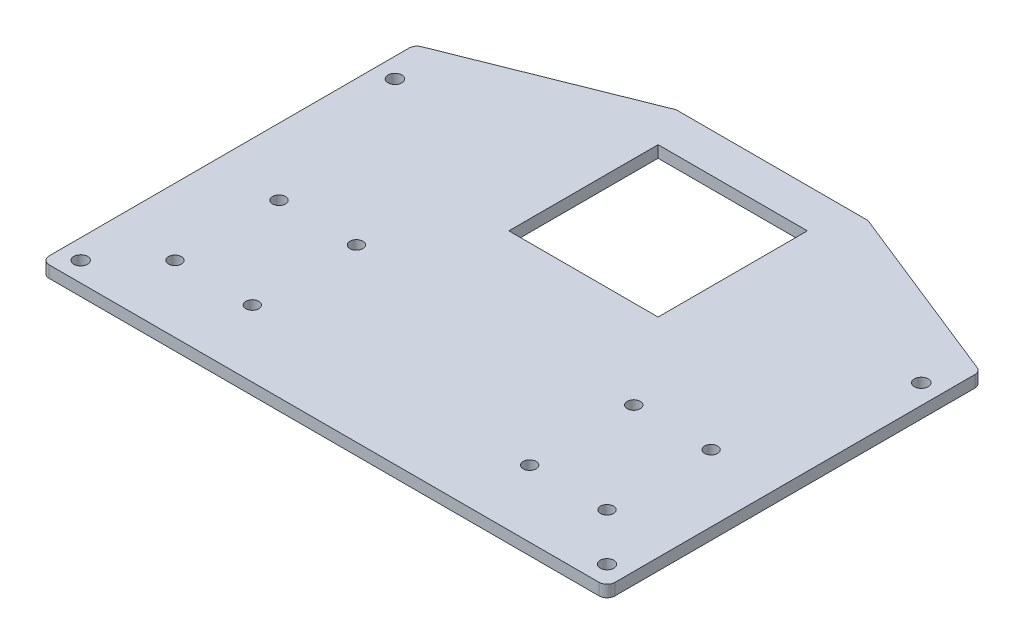
from build123d import *

# Parameters (mm, degrees)
SKETCH1_R           = 1.65
BOSS_EXTRUDE1_DEPTH = 3
CUT_EXTRUDE1_DEPTH  = 10
SKETCH6_R           = 1.75
SKETCH6_W           = 38
SKETCH6_H           = 38
CUT_EXTRUDE2_DEPTH  = 5


with BuildPart() as part:
    # Sketch1 → Boss-Extrude1 (new body)
    with BuildSketch(Plane(origin=(0, 0, 0), x_dir=(1, 0, 0), z_dir=(0, 1, 0))):
        with BuildLine():
            Line((-20.833630945, -24.478740106), (119.166369055, -24.478740106))
            ThreePointArc((119.166369055, -24.478740106), (122.701902961, -23.014274012), (124.166369055, -19.478740106))
            Line((124.166369055, -19.478740106), (124.166369055, 72.136095087))
            ThreePointArc((124.166369055, 72.136095087), (123.306705208, 74.939239133), (121.023322437, 76.778478541))
            Line((121.023322437, 76.778478541), (75.060410419, 95.163643348))
            ThreePointArc((75.060410419, 95.163643348), (74.148994643, 95.431041828), (73.203457037, 95.521259894))
            Line((73.203457037, 95.521259894), (25.129281073, 95.521259894))
            ThreePointArc((25.129281073, 95.521259894), (24.183743467, 95.431041828), (23.272327691, 95.163643348))
            Line((23.272327691, 95.163643348), (-22.690584327, 76.778478541))
            ThreePointArc((-22.690584327, 76.778478541), (-24.973967097, 74.939239133), (-25.833630945, 72.136095087))
            Line((-25.833630945, 72.136095087), (-25.833630945, -19.478740106))
            ThreePointArc((-25.833630945, -19.478740106), (-24.369164851, -23.014274012), (-20.833630945, -24.478740106))
        make_face()
        with Locations((-5.833630945, 22.021259894)):
            Circle(SKETCH1_R, mode=Mode.SUBTRACT)
        with Locations((13.866369055, 22.021259894)):
            Circle(SKETCH1_R, mode=Mode.SUBTRACT)
        with Locations((-5.833630945, -4.478740106)):
            Circle(SKETCH1_R, mode=Mode.SUBTRACT)
        with Locations((13.866369055, -4.478740106)):
            Circle(SKETCH1_R, mode=Mode.SUBTRACT)
        with Locations((84.466369055, -4.478740106)):
            Circle(SKETCH1_R, mode=Mode.SUBTRACT)
        with Locations((104.166369055, -4.478740106)):
            Circle(SKETCH1_R, mode=Mode.SUBTRACT)
        with Locations((104.166369055, 22.021259894)):
            Circle(SKETCH1_R, mode=Mode.SUBTRACT)
        with Locations((84.466369055, 22.021259894)):
            Circle(SKETCH1_R, mode=Mode.SUBTRACT)
    extrude(amount=BOSS_EXTRUDE1_DEPTH)

    # Sketch2 → Cut-Extrude1 (cut)
    with BuildSketch(Plane.XZ):
        with BuildLine():
            Line((-25.833630945, 19.478740106), (-25.833630945, -72.136095087))
            ThreePointArc((-25.833630945, -72.136095087), (-24.973967097, -74.939239133), (-22.690584327, -76.778478541))
            Line((-22.690584327, -76.778478541), (23.272327691, -95.163643348))
            ThreePointArc((23.272327691, -95.163643348), (24.183743467, -95.431041828), (25.129281073, -95.521259894))
            Line((25.129281073, -95.521259894), (73.203457037, -95.521259894))
            ThreePointArc((73.203457037, -95.521259894), (74.148994643, -95.431041828), (75.060410419, -95.163643348))
            Line((75.060410419, -95.163643348), (121.023322437, -76.778478541))
            ThreePointArc((121.023322437, -76.778478541), (123.306705208, -74.939239133), (124.166369055, -72.136095087))
            Line((124.166369055, -72.136095087), (124.166369055, 19.478740106))
            ThreePointArc((124.166369055, 19.478740106), (122.701902961, 23.014274012), (119.166369055, 24.478740106))
            Line((119.166369055, 24.478740106), (-20.833630945, 24.478740106))
            ThreePointArc((-20.833630945, 24.478740106), (-24.369164851, 23.014274012), (-25.833630945, 19.478740106))
        make_face()
        with BuildLine():
            Line((119.166369055, 21.478740106), (-20.833630945, 21.478740106))
            ThreePointArc((-20.833630945, 21.478740106), (-22.247844507, 20.892953668), (-22.833630945, 19.478740106))
            Line((-22.833630945, 19.478740106), (-22.833630945, -72.136095087))
            ThreePointArc((-22.833630945, -72.136095087), (-22.489765406, -73.257352705), (-21.576412297, -73.993048469))
            Line((-21.576412297, -73.993048469), (24.38649972, -92.378213276))
            ThreePointArc((24.38649972, -92.378213276), (24.751066031, -92.485172667), (25.129281073, -92.521259894))
            Line((25.129281073, -92.521259894), (73.203457037, -92.521259894))
            ThreePointArc((73.203457037, -92.521259894), (73.58167208, -92.485172667), (73.94623839, -92.378213276))
            Line((73.94623839, -92.378213276), (119.909150408, -73.993048469))
            ThreePointArc((119.909150408, -73.993048469), (120.822503516, -73.257352705), (121.166369055, -72.136095087))
            Line((121.166369055, -72.136095087), (121.166369055, 19.478740106))
            ThreePointArc((121.166369055, 19.478740106), (120.580582618, 20.892953668), (119.166369055, 21.478740106))
        make_face(mode=Mode.SUBTRACT)
    extrude(amount=-CUT_EXTRUDE1_DEPTH, mode=Mode.SUBTRACT)

    # Sketch6 → Cut-Extrude2 (cut)
    with BuildSketch(Plane(origin=(0, 3, 0), x_dir=(1, 0, 0), z_dir=(0, 1, 0))):
        with Locations((116.166369055, -16.478740106)):
            Circle(SKETCH6_R)
        with Locations((-17.833630945, -16.478740106)):
            Circle(SKETCH6_R)
        with Locations((116.166369055, 63.521259894)):
            Circle(SKETCH6_R)
        with Locations((-17.833630945, 63.521259894)):
            Circle(SKETCH6_R)
        with Locations((49.166369055, 63.521259894)):
            Rectangle(SKETCH6_W, SKETCH6_H)
    extrude(amount=-CUT_EXTRUDE2_DEPTH, mode=Mode.SUBTRACT)


solid = part.part
